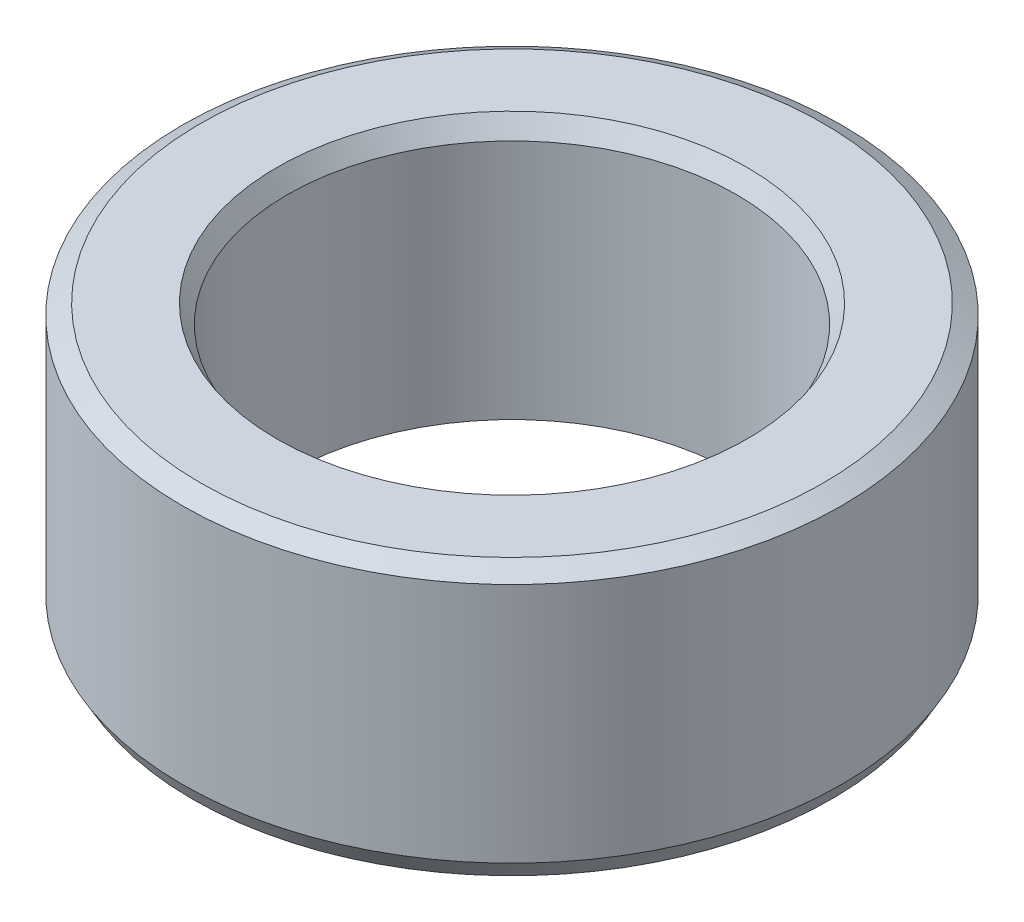
from build123d import *
from OCP.BRepFilletAPI import BRepFilletAPI_MakeChamfer

# Parameters (mm, degrees)
SKETCH1_R           = 45
BOSS_EXTRUDE1_DEPTH = 36.87575828
SKETCH2_R           = 30.658464794
CUT_EXTRUDE1_DEPTH  = 74.551489099
CHAMFER1_SIZE       = 1.441036213
CHAMFER1_SIZE2      = 2.495947936


with BuildPart() as part:
    # Sketch1 → Boss-Extrude1 (new body)
    with BuildSketch(Plane(origin=(0, 0, 0), x_dir=(1, 0, 0), z_dir=(0, 1, 0))):
        Circle(SKETCH1_R)
    extrude(amount=BOSS_EXTRUDE1_DEPTH)

    # Sketch2 → Cut-Extrude1 (cut, through all)
    with BuildSketch(Plane(origin=(0, 0, 0), x_dir=(1, 0, 0), z_dir=(0, 1, 0))):
        Circle(SKETCH2_R)
    extrude(amount=CUT_EXTRUDE1_DEPTH, mode=Mode.SUBTRACT)

    # Chamfer1: one chamfer whose edges measure the first distance from different faces: ONE call of the kernel's chamfer builder (chamfer() names one face for all edges)
    chamfer1_edges_1 = [part.edges().sort_by_distance(p)[0] for p in [
        (-30.658464794, 36.87575828, 0),
    ]]
    chamfer1_side_1 = [part.faces().sort_by_distance(p)[0] for p in [
        (-43.727207794, 36.87575828, 0),
    ]]
    chamfer1_edges_2 = [part.edges().sort_by_distance(p)[0] for p in [
        (-30.658464794, 0, 0),
    ]]
    chamfer1_side_2 = [part.faces().sort_by_distance(p)[0] for p in [
        (-30.658464794, 18.43787914, 0),
    ]]
    chamfer1_edges_3 = [part.edges().sort_by_distance(p)[0] for p in [
        (-45, 0, 0),
    ]]
    chamfer1_side_3 = [part.faces().sort_by_distance(p)[0] for p in [
        (-43.727207794, 0, 0),
    ]]
    chamfer1_edges_4 = [part.edges().sort_by_distance(p)[0] for p in [
        (-45, 36.87575828, 0),
    ]]
    chamfer1_side_4 = [part.faces().sort_by_distance(p)[0] for p in [
        (-45, 18.43787914, 0),
    ]]
    chamfer1 = BRepFilletAPI_MakeChamfer(part.part.solid().wrapped)
    for e in chamfer1_edges_1:
        chamfer1.Add(CHAMFER1_SIZE, CHAMFER1_SIZE2, e.wrapped, chamfer1_side_1[0].wrapped)  # the first distance lies on this face
    for e in chamfer1_edges_2:
        chamfer1.Add(CHAMFER1_SIZE, CHAMFER1_SIZE2, e.wrapped, chamfer1_side_2[0].wrapped)  # the first distance lies on this face
    for e in chamfer1_edges_3:
        chamfer1.Add(CHAMFER1_SIZE, CHAMFER1_SIZE2, e.wrapped, chamfer1_side_3[0].wrapped)  # the first distance lies on this face
    for e in chamfer1_edges_4:
        chamfer1.Add(CHAMFER1_SIZE, CHAMFER1_SIZE2, e.wrapped, chamfer1_side_4[0].wrapped)  # the first distance lies on this face
    add(Compound.cast(chamfer1.Shape()), mode=Mode.REPLACE)


solid = part.part
